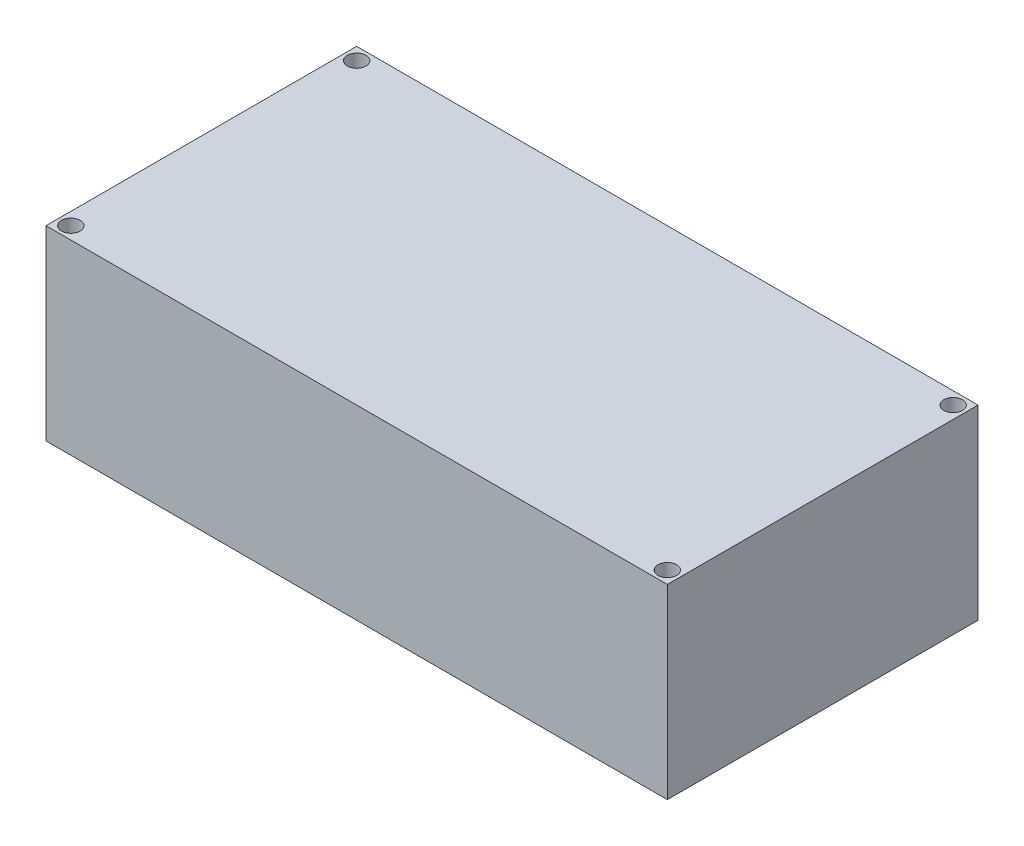
from build123d import *

# Parameters (mm, degrees)
ESQUISSE2_W             = 100
ESQUISSE2_H             = 50
BOSS_EXTRU_1_DEPTH      = 30
ESQUISSE3_R             = 1.5
ENL_V_MAT_EXTRU_1_DEPTH = 30


with BuildPart() as part:
    # Esquisse2 → Boss.-Extru.1 (new body)
    with BuildSketch(Plane(origin=(0, 0, 0), x_dir=(1, 0, 0), z_dir=(0, 1, 0))):
        Rectangle(ESQUISSE2_W, ESQUISSE2_H)
    extrude(amount=BOSS_EXTRU_1_DEPTH)

    # Esquisse3 → Enlèv. mat.-Extru.1 (cut)
    with BuildSketch(Plane(origin=(0, 30, 0), x_dir=(1, 0, 0), z_dir=(0, 1, 0))):
        with Locations((-48, 23)):
            Circle(ESQUISSE3_R)
        with Locations((-48, -23)):
            Circle(ESQUISSE3_R)
        with Locations((48, -23)):
            Circle(ESQUISSE3_R)
        with Locations((48, 23)):
            Circle(ESQUISSE3_R)
    extrude(amount=-ENL_V_MAT_EXTRU_1_DEPTH, mode=Mode.SUBTRACT)


solid = part.part
